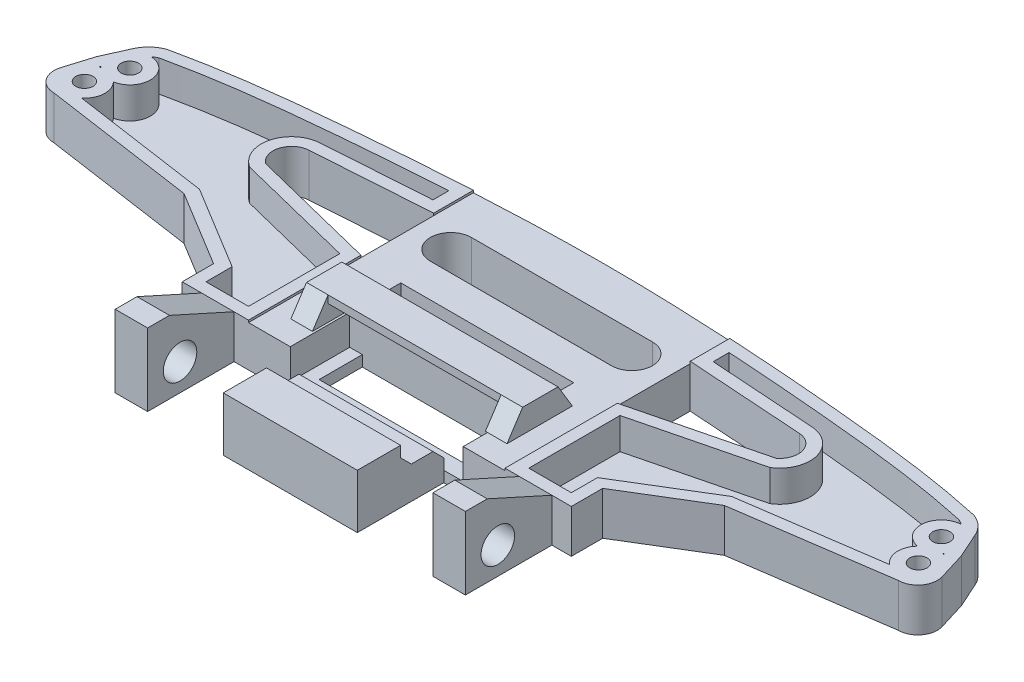
from build123d import *

# Parameters (mm, degrees)
SKETCH_1_R          = 0.8
EXTRUDE_1_DEPTH     = 4
EXTRUDE_1_2_DEPTH   = 4
SHELL_START         = 1.1
SHELL_1_DEPTH       = 2.9
SHELL_2_DEPTH       = 2.9
EXTRUDE_2_DEPTH     = 3.8
EXTRUDE_3_DEPTH     = 6.7
CUT_EXTRUDE_1_REACH = 61.796
SKETCH_2_R          = 1.55
SKETCH_1_8_W        = 12.4
SKETCH_1_8_H        = 4
EXTRUDE_4_DEPTH     = 5
SKETCH_1_9_W        = 12.4
SKETCH_1_9_H        = 4
EXTRUDE_5_DEPTH     = 3
SKETCH_4_W          = 10.225209141
SKETCH_4_H          = 3
CUT_EXTRUDE_2_DEPTH = 8
EXTRUDE_6_DEPTH     = 8
CHAMFER_2_SIZE      = 1
CUT_EXTRUDE_3_REACH = 46.463
SKETCH_5_W          = 13.670536166
SKETCH_5_H          = 4
EXTRUDE_7_DEPTH     = 2
EXTRUDE_8_DEPTH     = 2


# Read off the part's stored shape, not the designer's step: 抽壳1, 抽壳2
with BuildPart() as part:
    # 草图1 → 凸台-拉伸1 (new body)
    with BuildSketch(Plane(origin=(0, 0, 0), x_dir=(1, 0, 0), z_dir=(0, 1, 0))):
        with BuildLine():
            Line((-38.955047023, 7.821727849), (-40, 5.497253113))
            Line((-40, 5.497253113), (-40.77955606, 2.949505742))
            ThreePointArc((-40.77955606, 2.949505742), (-40.504474517, 1.346993245), (-39.052576122, 0.615073027))
            Line((-39.052576122, 0.615073027), (-24.994346595, -1.426160931))
            Line((-24.994346595, -1.426160931), (-18, -5.682344474))
            Line((-18, -5.682344474), (-18, -7.907195239))
            Line((-18, -7.907195239), (-18, -8.583774419))
            Line((-18, -8.583774419), (-16.2, -8.583774419))
            Line((-16.2, -8.583774419), (-13.2, -8.583774419))
            Line((-13.2, -8.583774419), (-11.864152132, -8.583774419))
            Line((-11.864152132, -8.583774419), (-11.864152132, 1.816116694))
            Line((-11.864152132, 1.816116694), (-23.607515724, 4.744990109))
            ThreePointArc((-23.607515724, 4.744990109), (-24.222579515, 6.600184076), (-22.6968407, 7.821727849))
            Line((-22.6968407, 7.821727849), (-11.864152132, 8.550979368))
            Line((-11.864152132, 8.550979368), (-11.864152132, 12.216007808))
            add(Edge.make_bspline(
                [(-37.306158033, 9.344134331), (-32.243149696, 10.464367383), (-23.74070699, 11.373301084), (-15.22297712, 12.025116643), (-11.864152132, 12.216007808)],
                knots=[0, 0, 0, 0, 0.414185108, 0.683413281, 0.683413281, 0.683413281, 0.683413281], degree=3))
            ThreePointArc((-37.306158033, 9.344134331), (-38.286010375, 8.751250321), (-38.955047023, 7.821727849))
        make_face()
        with Locations(Location((-38.578524063, 2.949505742, 0), (0, 0, 270))):
            Circle(SKETCH_1_R, mode=Mode.SUBTRACT)
        with Locations(Location((-37.541177719, 6.114568519, 0), (0, 0, 270))):
            Circle(SKETCH_1_R, mode=Mode.SUBTRACT)
    extrude(amount=EXTRUDE_1_DEPTH)

    # 抽壳1 outline → 抽壳1 (cut)
    with BuildSketch(Plane(origin=(0, 0, 0), x_dir=(1, 0, 0), z_dir=(0, 1, 0)).offset(SHELL_START)):
        with BuildLine():
            add(Edge.make_bspline(
                [(-36.993408852, 8.286685168), (-36.098286844, 8.483694138), (-35.200302982, 8.667538668), (-34.299585327, 8.839032137), (-33.396266824, 8.998989181), (-32.490484639, 9.148226017), (-31.582379503, 9.287560771), (-30.672095061, 9.417813797), (-29.759777207, 9.539808003), (-28.845573435, 9.654369179), (-27.46781812, 9.816757889), (-27.005562352, 9.869510593), (-26.542883967, 9.920690638), (-26.079802096, 9.97040442), (-25.616335904, 10.018758526), (-25.152504588, 10.065859726), (-24.68832738, 10.11181498), (-24.223823544, 10.156731435), (-23.759012379, 10.200716425), (-23.177638427, 10.254667733), (-23.061345635, 10.265406495), (-22.945035143, 10.276095439), (-22.828707252, 10.286736249), (-22.712362263, 10.297330607), (-22.596000478, 10.307880196), (-22.479622198, 10.318386698), (-22.363227725, 10.328851796), (-22.24681736, 10.339277173), (-22.013965448, 10.360051849), (-21.897519546, 10.37040191), (-21.781100487, 10.380709553), (-21.664491721, 10.391003462), (-21.548235373, 10.401229156), (-21.431606214, 10.411447476), (-21.315237392, 10.421610421), (-21.198748791, 10.43174392), (-21.082294706, 10.441837681), (-20.732919666, 10.472005835), (-20.500004346, 10.491966025), (-20.267090307, 10.511771617), (-20.034177453, 10.531419925), (-19.801265692, 10.550908263), (-19.568354929, 10.570233946), (-19.335445071, 10.589394289), (-19.102536025, 10.608386606), (-18.869627696, 10.627208212), (-18.069462901, 10.691274964), (-17.502209419, 10.735664938), (-16.93495823, 10.778987573), (-16.367708006, 10.821204115), (-15.800457412, 10.862275827), (-15.233205098, 10.902163986), (-14.665949707, 10.940829887), (-14.098689869, 10.978234837), (-13.531424205, 11.014340162), (-12.964151325, 11.049107202)],
                knots=[0.002080614, 0.002080614, 0.002080614, 0.002080614, 0.002080614, 0.002080614, 0.002080614, 0.002080614, 0.002080614, 0.002080614, 0.002080614, 0.25, 0.25, 0.25, 0.25, 0.25, 0.25, 0.25, 0.25, 0.25, 0.375, 0.375, 0.375, 0.375, 0.375, 0.375, 0.375, 0.375, 0.375, 0.40625, 0.40625, 0.40625, 0.40625, 0.40625, 0.40625, 0.40625, 0.40625, 0.40625, 0.4375, 0.4375, 0.4375, 0.4375, 0.4375, 0.4375, 0.4375, 0.4375, 0.4375, 0.5, 0.5, 0.5, 0.5, 0.5, 0.5, 0.5, 0.5, 0.5, 0.652221534, 0.652221534, 0.652221534, 0.652221534, 0.652221534, 0.652221534, 0.652221534, 0.652221534, 0.652221534, 0.652221534, 0.652221534], degree=10))
            ThreePointArc((-36.993408852, 8.286685168), (-37.237027936, 8.167725428), (-37.459522527, 8.012813084))
            ThreePointArc((-37.459522527, 8.012813084), (-35.646000804, 6.249862487), (-37.190698896, 4.247173382))
            ThreePointArc((-37.190698896, 4.247173382), (-36.682557551, 2.825768181), (-37.371133658, 1.482465044))
            Line((-37.371133658, 1.482465044), (-24.614219721, -0.369819831))
            Line((-24.614219721, -0.369819831), (-16.9, -5.064058897))
            Line((-16.9, -5.064058897), (-16.9, -7.483774419))
            Line((-16.9, -7.483774419), (-12.964152132, -7.483774419))
            Line((-12.964152132, -7.483774419), (-12.964152132, 0.956768116))
            Line((-12.964152132, 0.956768116), (-24.061700424, 3.724570876))
            ThreePointArc((-24.061700424, 3.724570876), (-25.309956638, 6.792538863), (-22.770724955, 8.919243733))
            Line((-22.770724955, 8.919243733), (-12.964152132, 9.579417622))
            Line((-12.964152132, 9.579417622), (-12.964151325, 11.049107202))
        make_face()
        with BuildLine():
            Line((-39.024190253, 4.926850612), (-39.067432726, 4.785525437))
            ThreePointArc((-39.067432726, 4.785525437), (-38.9985109, 4.802506297), (-38.929002887, 4.816900878))
            ThreePointArc((-38.929002887, 4.816900878), (-38.977648921, 4.870964688), (-39.024190253, 4.926850612))
        make_face()
    extrude(amount=SHELL_1_DEPTH, mode=Mode.SUBTRACT)



with BuildPart() as body_2:
    # 草图1 → Extrude 1 2 (new body)
    with BuildSketch(Plane(origin=(0, 0, 0), x_dir=(1, 0, 0), z_dir=(0, 1, 0))):
        with BuildLine():
            add(Edge.make_bspline(
                [(37.306158033, 9.344134331), (32.243149696, 10.464367383), (23.74070699, 11.373301084), (15.22297712, 12.025116643), (11.864152132, 12.216007808)],
                knots=[0, 0, 0, 0, 0.414185108, 0.683413281, 0.683413281, 0.683413281, 0.683413281], degree=3))
            Line((11.864152132, 12.216007808), (11.864152132, 8.550979368))
            Line((11.864152132, 8.550979368), (22.6968407, 7.821727849))
            ThreePointArc((22.6968407, 7.821727849), (24.222579515, 6.600184076), (23.607515724, 4.744990109))
            Line((23.607515724, 4.744990109), (11.864152132, 1.816116694))
            Line((11.864152132, 1.816116694), (11.864152132, -8.583774419))
            Line((11.864152132, -8.583774419), (13.2, -8.583774419))
            Line((13.2, -8.583774419), (16.2, -8.583774419))
            Line((16.2, -8.583774419), (18, -8.583774419))
            Line((18, -8.583774419), (18, -7.907195239))
            Line((18, -7.907195239), (18, -5.682344474))
            Line((18, -5.682344474), (24.994346595, -1.426160931))
            Line((24.994346595, -1.426160931), (39.052576122, 0.615073027))
            ThreePointArc((39.052576122, 0.615073027), (40.504474517, 1.346993245), (40.77955606, 2.949505742))
            Line((40.77955606, 2.949505742), (40, 5.497253113))
            Line((40, 5.497253113), (38.955047023, 7.821727849))
            ThreePointArc((38.955047023, 7.821727849), (38.286010375, 8.751250321), (37.306158033, 9.344134331))
        make_face()
        with Locations(Location((38.578524063, 2.949505742, 0), (0, 0, 270))):
            Circle(SKETCH_1_R, mode=Mode.SUBTRACT)
        with Locations(Location((37.541177719, 6.114568519, 0), (0, 0, 270))):
            Circle(SKETCH_1_R, mode=Mode.SUBTRACT)
    extrude(amount=EXTRUDE_1_2_DEPTH)

    # 抽壳2 outline → 抽壳2 (cut)
    with BuildSketch(Plane(origin=(0, 0, 0), x_dir=(1, 0, 0), z_dir=(0, 1, 0)).offset(SHELL_START)):
        with BuildLine():
            ThreePointArc((37.459522527, 8.012813084), (37.237027936, 8.167725428), (36.993408852, 8.286685168))
            add(Edge.make_bspline(
                [(36.993408852, 8.286685168), (36.098286844, 8.483694138), (35.200302982, 8.667538668), (34.299585327, 8.839032137), (33.396266824, 8.998989181), (32.490484639, 9.148226017), (31.582379503, 9.287560771), (30.672095061, 9.417813797), (29.759777207, 9.539808003), (28.845573435, 9.654369179), (27.46781812, 9.816757889), (27.005562352, 9.869510593), (26.542883967, 9.920690638), (26.079802096, 9.97040442), (25.616335904, 10.018758526), (25.152504588, 10.065859726), (24.68832738, 10.11181498), (24.223823544, 10.156731435), (23.759012379, 10.200716425), (23.177638427, 10.254667733), (23.061345635, 10.265406495), (22.945035143, 10.276095439), (22.828707252, 10.286736249), (22.712362263, 10.297330607), (22.596000478, 10.307880196), (22.479622198, 10.318386698), (22.363227725, 10.328851796), (22.24681736, 10.339277173), (22.013965448, 10.360051849), (21.897519546, 10.37040191), (21.781100487, 10.380709553), (21.664491721, 10.391003462), (21.548235373, 10.401229156), (21.431606214, 10.411447476), (21.315237392, 10.421610421), (21.198748791, 10.43174392), (21.082294706, 10.441837681), (20.732919666, 10.472005835), (20.500004346, 10.491966025), (20.267090307, 10.511771617), (20.034177453, 10.531419925), (19.801265692, 10.550908263), (19.568354929, 10.570233946), (19.335445071, 10.589394289), (19.102536025, 10.608386606), (18.869627696, 10.627208212), (18.069462901, 10.691274964), (17.502209419, 10.735664938), (16.93495823, 10.778987573), (16.367708006, 10.821204115), (15.800457412, 10.862275827), (15.233205098, 10.902163986), (14.665949707, 10.940829887), (14.098689869, 10.978234837), (13.531424205, 11.014340162), (12.964151325, 11.049107202)],
                knots=[0.002080614, 0.002080614, 0.002080614, 0.002080614, 0.002080614, 0.002080614, 0.002080614, 0.002080614, 0.002080614, 0.002080614, 0.002080614, 0.25, 0.25, 0.25, 0.25, 0.25, 0.25, 0.25, 0.25, 0.25, 0.375, 0.375, 0.375, 0.375, 0.375, 0.375, 0.375, 0.375, 0.375, 0.40625, 0.40625, 0.40625, 0.40625, 0.40625, 0.40625, 0.40625, 0.40625, 0.40625, 0.4375, 0.4375, 0.4375, 0.4375, 0.4375, 0.4375, 0.4375, 0.4375, 0.4375, 0.5, 0.5, 0.5, 0.5, 0.5, 0.5, 0.5, 0.5, 0.5, 0.652221534, 0.652221534, 0.652221534, 0.652221534, 0.652221534, 0.652221534, 0.652221534, 0.652221534, 0.652221534, 0.652221534, 0.652221534], degree=10))
            Line((12.964151325, 11.049107202), (12.964152132, 9.579417622))
            Line((12.964152132, 9.579417622), (22.770724955, 8.919243733))
            ThreePointArc((22.770724955, 8.919243733), (25.309956638, 6.792538863), (24.061700424, 3.724570876))
            Line((24.061700424, 3.724570876), (12.964152132, 0.956768116))
            Line((12.964152132, 0.956768116), (12.964152132, -7.483774419))
            Line((12.964152132, -7.483774419), (16.9, -7.483774419))
            Line((16.9, -7.483774419), (16.9, -5.064058897))
            Line((16.9, -5.064058897), (24.614219721, -0.369819831))
            Line((24.614219721, -0.369819831), (37.371133658, 1.482465044))
            ThreePointArc((37.371133658, 1.482465044), (36.682557551, 2.825768181), (37.190698896, 4.247173382))
            ThreePointArc((37.190698896, 4.247173382), (35.646000804, 6.249862487), (37.459522527, 8.012813084))
        make_face()
        with BuildLine():
            ThreePointArc((39.024190253, 4.926850612), (38.977648921, 4.870964688), (38.929002887, 4.816900878))
            ThreePointArc((38.929002887, 4.816900878), (38.9985109, 4.802506297), (39.067432726, 4.785525437))
            Line((39.067432726, 4.785525437), (39.024190253, 4.926850612))
        make_face()
    extrude(amount=SHELL_2_DEPTH, mode=Mode.SUBTRACT)


with BuildPart() as part_1:
    add(part.part)

    add(body_2.part)  # 凸台-拉伸2 merges body 2
    # 草图1<3> → 凸台-拉伸2 (add)
    with BuildSketch(Plane(origin=(0, 0, 0), x_dir=(1, 0, 0), z_dir=(0, 1, 0))):
        with BuildLine():
            add(Edge.make_bspline(
                [(-11.864152132, 12.216007808), (-7.914493484, 12.440477659), (-3.960276832, 12.573839069), (0, 12.573839069)],
                knots=[0.683413281, 0.683413281, 0.683413281, 0.683413281, 1, 1, 1, 1], degree=3))
            Line((-11.864152132, 12.216007808), (-11.864152132, 8.550979368))
            Line((-11.864152132, 8.550979368), (-11.864152132, 1.816116694))
            Line((-11.864152132, 1.816116694), (-11.864152132, -8.583774419))
            Line((-11.864152132, -8.583774419), (-6.2, -8.583774419))
            Line((-6.2, -8.583774419), (6.2, -8.583774419))
            Line((6.2, -8.583774419), (11.864152132, -8.583774419))
            Line((11.864152132, -8.583774419), (11.864152132, 1.816116694))
            Line((11.864152132, 1.816116694), (11.864152132, 8.550979368))
            Line((11.864152132, 8.550979368), (11.864152132, 12.216007808))
            add(Edge.make_bspline(
                [(11.864152132, 12.216007808), (7.914493484, 12.440477659), (3.960276832, 12.573839069), (0, 12.573839069)],
                knots=[0.683413281, 0.683413281, 0.683413281, 0.683413281, 1, 1, 1, 1], degree=3))
        make_face()
        with BuildLine():
            ThreePointArc((-8.372341541, 4.744990109), (-10.275336171, 6.647984738), (-8.372341541, 8.550979368))
            Line((-8.372341541, 8.550979368), (8.372341541, 8.550979368))
            ThreePointArc((8.372341541, 8.550979368), (10.275336171, 6.647984738), (8.372341541, 4.744990109))
            Line((8.372341541, 4.744990109), (-8.372341541, 4.744990109))
        make_face(mode=Mode.SUBTRACT)
    extrude(amount=EXTRUDE_2_DEPTH)

    # 草图1<5> → 凸台-拉伸3 (add)
    with BuildSketch(Plane(origin=(0, 0, 0), x_dir=(1, 0, 0), z_dir=(0, 1, 0))):
        Polygon((-13.2, -12.583774419), (-13.2, -8.583774419), (-16.2, -8.583774419), (-16.2, -16.583774419), (-13.2, -16.583774419), align=None)
        Polygon((16.2, -8.583774419), (13.2, -8.583774419), (13.2, -12.583774419), (13.2, -16.583774419), (16.2, -16.583774419), align=None)
    extrude(amount=EXTRUDE_3_DEPTH)

    # 草图2 → 切除-拉伸1 (cut, up to next)
    with BuildSketch(Plane.ZY.offset(16.2), mode=Mode.PRIVATE) as cut_extrude_1_sk1:
        with Locations((13.583774419, 2.5)):
            Circle(SKETCH_2_R)
    cut_extrude_1_tool1 = extrude(cut_extrude_1_sk1.sketch, amount=-CUT_EXTRUDE_1_REACH, mode=Mode.PRIVATE) & part_1.part
    # 草图2 → 切除-拉伸1 (cut, up to next)
    with BuildSketch(Plane.ZY.offset(16.2), mode=Mode.PRIVATE) as cut_extrude_1_sk2:
        Polygon((8.583774419, 4), (14.562965252, 6.7), (8.583774419, 6.7), align=None)
    cut_extrude_1_tool2 = extrude(cut_extrude_1_sk2.sketch, amount=-CUT_EXTRUDE_1_REACH, mode=Mode.PRIVATE) & part_1.part
    cut_extrude_1_1 = cut_extrude_1_tool1.solids().sort_by_distance((-16.2, 2.5, 13.583774))[0]
    add(cut_extrude_1_1, mode=Mode.SUBTRACT)
    cut_extrude_1_2 = cut_extrude_1_tool2.solids().sort_by_distance((-16.2, 5.8, 10.576838))[0]
    add(cut_extrude_1_2, mode=Mode.SUBTRACT)
    cut_extrude_1 = cut_extrude_1_1 + cut_extrude_1_2  # 切除-拉伸1 as one shape, for the pattern or mirror that repeats it

    # 镜向1: 切除-拉伸1 across plane
    add(cut_extrude_1.mirror(Plane(origin=(0, 0, 0), x_dir=(0, 0, 1), z_dir=(1, 0, 0))), mode=Mode.SUBTRACT)



with BuildPart() as body_2_2:
    # 草图1<8> → 凸台-拉伸4 (new body)
    with BuildSketch(Plane(origin=(0, 0, 0), x_dir=(1, 0, 0), z_dir=(0, 1, 0))):
        with Locations((0, -14.583774419)):
            Rectangle(SKETCH_1_8_W, SKETCH_1_8_H)
    extrude(amount=EXTRUDE_4_DEPTH)


with BuildPart() as part_2:
    add(part_1.part)

    add(body_2_2.part)  # 凸台-拉伸5 merges body 2 2
    # 草图1<9> → 凸台-拉伸5 (add)
    with BuildSketch(Plane(origin=(0, 0, 0), x_dir=(1, 0, 0), z_dir=(0, 1, 0))):
        with Locations((0, -10.583774419)):
            Rectangle(SKETCH_1_9_W, SKETCH_1_9_H)
    extrude(amount=EXTRUDE_5_DEPTH)

    # 草图4 → 切除-拉伸2 (cut, symmetric)
    with BuildSketch(Plane(origin=(0, 0, 0), x_dir=(0, 0, -1), z_dir=(1, 0, 0))):
        with Locations((-3.471169849, 2.5)):
            Rectangle(SKETCH_4_W, SKETCH_4_H)
    extrude(amount=CUT_EXTRUDE_2_DEPTH, both=True, mode=Mode.SUBTRACT)

    # 草图3 → 凸台-拉伸6 (add, symmetric)
    with BuildSketch(Plane(origin=(0, 0, 0), x_dir=(0, 0, -1), z_dir=(1, 0, 0))):
        Polygon((-3.083774419, 0.7), (-1.817264794, 0.7), (0, 0.7), (1.061942668, 0.7), (0, 3.2), (-1.817264794, 6.2), (-5.083774419, 6.2), (-5.083774419, 5.5), (-3.083774419, 5.5), (-3.083774419, 3.2), align=None)
    extrude(amount=EXTRUDE_6_DEPTH, both=True)

    # 倒角2
    chamfer_2_edges = [part_2.edges().sort_by_distance(p)[0] for p in [
        (0, 3, 8.583774419),
        (0, 3, 12.583774419),
    ]]
    chamfer(chamfer_2_edges, length=CHAMFER_2_SIZE)

    # 草图5 → 切除-拉伸3 (cut, up to next)
    with BuildSketch(Plane(origin=(0, 1, 0), x_dir=(1, 0, 0), z_dir=(0, 1, 0)), mode=Mode.PRIVATE) as cut_extrude_3_sk1:
        with Locations((0, -5.083774419)):
            Rectangle(SKETCH_5_W, SKETCH_5_H)
    cut_extrude_3_tool1 = extrude(cut_extrude_3_sk1.sketch, amount=-CUT_EXTRUDE_3_REACH, mode=Mode.PRIVATE) & part_2.part
    add(cut_extrude_3_tool1.solids().sort_by_distance((0, 1, 5.083774))[0], mode=Mode.SUBTRACT)

    # 草图6 → 凸台-拉伸7 (add)
    with BuildSketch(Plane.ZY.offset(8)):
        Polygon((1.817264794, 6.2), (0.484603945, 4), (6.533687956, 4), (5.083774419, 6.2), align=None)
    extrude(amount=EXTRUDE_7_DEPTH)

    # 草图7 → 凸台-拉伸8 (add)
    with BuildSketch(Plane(origin=(8, 0, 0), x_dir=(0, 0, -1), z_dir=(1, 0, 0))):
        Polygon((-1.817264794, 6.2), (-5.083774419, 6.2), (-6.533687956, 4), (-0.484603945, 4), align=None)
    extrude(amount=EXTRUDE_8_DEPTH)


solid = part_2.part
